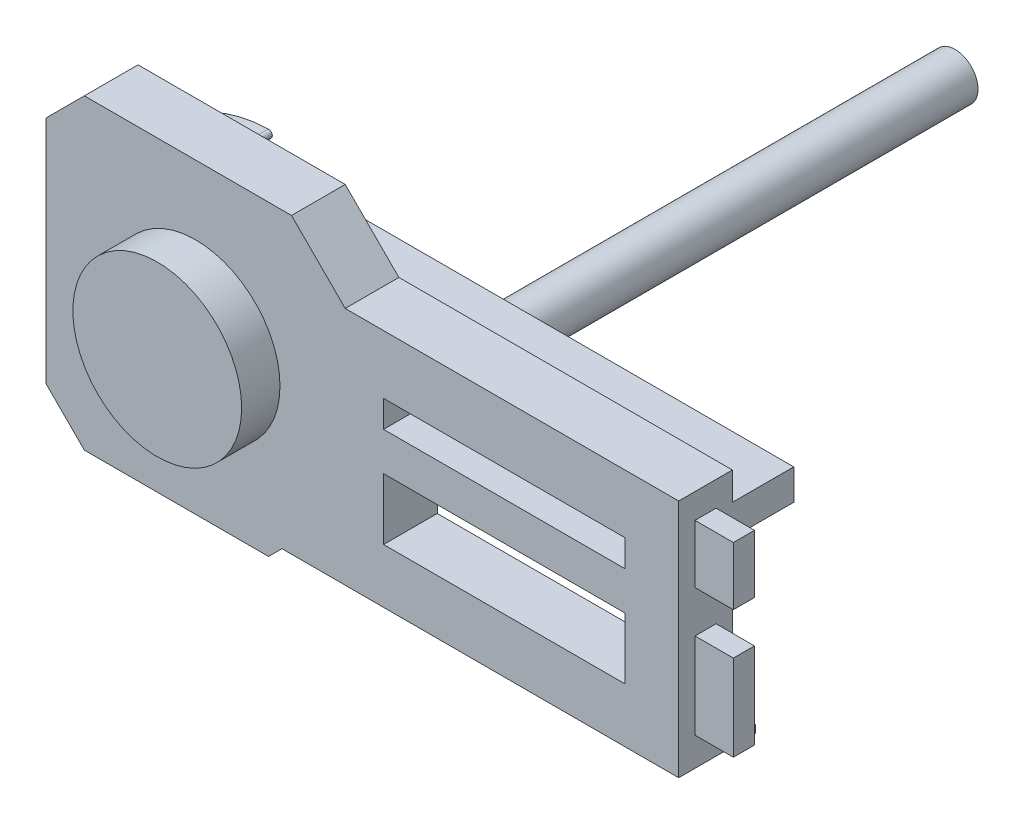
from build123d import *

# Parameters (mm, degrees)
SKETCH1_R               = 5.35
BOSS_EXTRUDE2_DEPTH     = 7
BOSS_EXTRUDE3_START     = 8
SKETCH3_R               = 5.35
BOSS_EXTRUDE3_DEPTH     = 8
BOSS_EXTRUDE4_DEPTH     = 3
CHAMFER1_SIZE           = 10
CHAMFER2_SIZE           = 5
CUT_EXTRUDE1_DEPTH      = 67.560662475
CUT_EXTRUDE1_DEPTH_BACK = 67.560662475
SKETCH5_W               = 31.474956737
SKETCH5_H               = 3.5
SKETCH5_H_2             = 8
CHAMFER3_SIZE           = 7
SKETCH6_R               = 11
BOSS_EXTRUDE5_DEPTH     = 5
SKETCH8_W               = 2.75
SKETCH8_H               = 7.59
SKETCH8_H_2             = 11.2
BOSS_EXTRUDE6_DEPTH     = 5
SKETCH9_R               = 3
BOSS_EXTRUDE7_DEPTH     = 72
CUT_EXTRUDE2_REACH      = 127.169
SKETCH10_W              = 8
SKETCH10_H              = 4
FILLET1_R               = 0.5


# Some blends are built 0.0001 mm under size
with BuildPart() as part:
    # Sketch1 → Boss-Extrude2 (new body)
    with BuildSketch(Plane.XY):
        Polygon((-19.503784034, -20), (19.503784034, -20), (19.503784034, -18.25), (62.978740771, -18.25), (62.978740771, 13), (19.503784034, 13), (19.503784034, 20), (-19.503784034, 20), align=None)
        Circle(SKETCH1_R, mode=Mode.SUBTRACT)
    extrude(amount=-BOSS_EXTRUDE2_DEPTH)

    # Sketch3 → Boss-Extrude3 (add)
    with BuildSketch(Plane.XY.offset(BOSS_EXTRUDE3_START)):
        with BuildLine():
            Line((7.668115805, 5.35), (62.978740771, 5.35))
            Line((62.978740771, 5.35), (62.978740771, 9.35))
            Line((62.978740771, 9.35), (0, 9.35))
            ThreePointArc((0, 9.35), (-9.35, 0), (0, -9.35))
            Line((0, -9.35), (62.978740771, -9.35))
            Line((62.978740771, -9.35), (62.978740771, -5.35))
            Line((62.978740771, -5.35), (7.668115805, -5.35))
            ThreePointArc((7.668115805, -5.35), (9.35, 0), (7.668115805, 5.35))
        make_face()
        Circle(SKETCH3_R, mode=Mode.SUBTRACT)
    extrude(amount=-BOSS_EXTRUDE3_DEPTH)

    # Sketch4 → Boss-Extrude4 (add)
    with BuildSketch(Plane.XY):
        with BuildLine():
            Line((0, -18.25), (62.978740771, -18.25))
            Line((62.978740771, -18.25), (62.978740771, -17.25))
            Line((62.978740771, -17.25), (8.306623863, -17.25))
            Line((8.306623863, -17.25), (0, -17.25))
            ThreePointArc((0, -17.25), (-17.25, 0), (0, 17.25))
            Line((0, 17.25), (0, 18.25))
            ThreePointArc((0, 18.25), (-18.25, 0), (0, -18.25))
        make_face()
    extrude(amount=BOSS_EXTRUDE4_DEPTH)

    # Chamfer1
    # the kernel refuses this chamfer: 10 mm, written as the material it takes off along each edge
    with BuildSketch(Plane(origin=(19.503784034, -20, 25.71682988), x_dir=(-0.9996219169112968, -0.027495876610586317, 0), z_dir=(0, 0, -1))) as chamfer1_piece_1_section:
        Polygon((CHAMFER1_SIZE * 0.999621916911, CHAMFER1_SIZE * 0.0274958766106), (-CHAMFER1_SIZE * 0.0274958766106, CHAMFER1_SIZE * 0.999621916911), (0, 0), align=None)
    chamfer1_piece_1 = extrude(amount=58.433659759, mode=Mode.PRIVATE)
    chamfer1_piece_1 = split(chamfer1_piece_1, bisect_by=Plane(origin=(14.814200223, -18.25, -3.5), z_dir=(0, -1, 0)), keep=Keep.TOP, mode=Mode.PRIVATE)
    add(chamfer1_piece_1, mode=Mode.SUBTRACT)

    # Chamfer2
    chamfer2_edges = [part.edges().sort_by_distance(p)[0] for p in [
        (-19.503784034, -20, -3.5),
        (-19.503784034, 20, -3.5),
    ]]
    chamfer(chamfer2_edges, length=CHAMFER2_SIZE)

    # Sketch5 → Cut-Extrude1 (cut, two sides: drawn at the far end of the back side and taken through both)
    with BuildSketch(Plane.XY.offset(-CUT_EXTRUDE1_DEPTH_BACK)):
        with Locations((40.241262403, 3.6)):
            Rectangle(SKETCH5_W, SKETCH5_H)
        with Locations((40.241262403, -7.15)):
            Rectangle(SKETCH5_W, SKETCH5_H_2)
    extrude(amount=CUT_EXTRUDE1_DEPTH + CUT_EXTRUDE1_DEPTH_BACK, mode=Mode.SUBTRACT)

    # Chamfer3
    chamfer3_edges = [part.edges().sort_by_distance(p)[0] for p in [
        (19.503784034, 20, -3.5),
    ]]
    chamfer(chamfer3_edges, length=CHAMFER3_SIZE - 0.0001)  # a hair under: the kernel refuses the full size


with BuildPart() as body_2:
    # Mirror9: mirrored copy
    add(part.part.mirror(Plane.XY.offset(-10)))

    # Sketch6 → Boss-Extrude5 (add)
    with BuildSketch(Plane.XY.offset(-13)):
        Circle(SKETCH6_R)
    extrude(amount=BOSS_EXTRUDE5_DEPTH)

    # Sketch8 → Boss-Extrude6 (add)
    with BuildSketch(Plane(origin=(62.978740771, 0, 0), x_dir=(0, 0, -1), z_dir=(1, 0, 0))):
        with Locations((16.5, 5.955)):
            Rectangle(SKETCH8_W, SKETCH8_H)
        with Locations((16.5, -8.9)):
            Rectangle(SKETCH8_W, SKETCH8_H_2)
    extrude(amount=BOSS_EXTRUDE6_DEPTH)

    # Sketch9 → Boss-Extrude7 (add)
    with BuildSketch(Plane(origin=(0, 0, -20), x_dir=(-1, 0, 0), z_dir=(0, 0, -1))):
        with Locations((-20.003784034, 0)):
            Circle(SKETCH9_R)
    extrude(amount=BOSS_EXTRUDE7_DEPTH)

    # Sketch10 → Cut-Extrude2 (cut, up to next)
    with BuildSketch(Plane(origin=(62.978740771, 0, 0), x_dir=(0, 0, -1), z_dir=(1, 0, 0)), mode=Mode.PRIVATE) as cut_extrude2_sk1:
        with Locations((24, -7.35)):
            Rectangle(SKETCH10_W, SKETCH10_H)
    cut_extrude2_tool1 = extrude(cut_extrude2_sk1.sketch, amount=-CUT_EXTRUDE2_REACH, mode=Mode.PRIVATE) & body_2.part
    add(cut_extrude2_tool1.solids().sort_by_distance((62.978741, -7.35, -24))[0], mode=Mode.SUBTRACT)

    # Fillet1
    fillet1_edges = [body_2.edges().sort_by_distance(p)[0] for p in [
        (0, 18.25, -21.5),
        (0, 17.25, -21.5),
    ]]
    fillet(fillet1_edges, radius=FILLET1_R - 0.0001)  # a hair under: the kernel refuses the full size


solid = body_2.part
